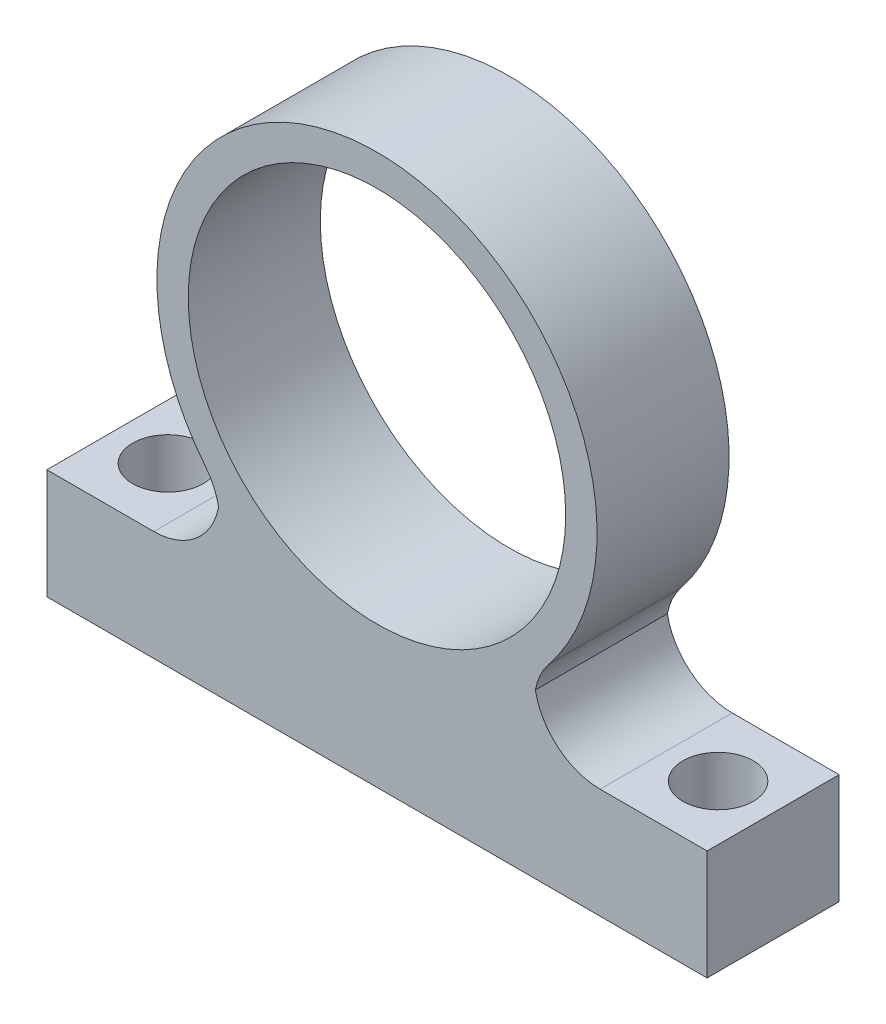
from build123d import *

# Parameters (mm, degrees)
IZIM1_R                     = 10
IZIM1_R_2                   = 8.575
IZIM1_W                     = 30
IZIM1_H                     = 5
Y_KSEKLIK_EKSTR_ZYON1_DEPTH = 6
RADYUS1_R                   = 3
IZIM3_R                     = 1.6
KES_EKSTR_ZYON1_DEPTH       = 6
IZIM2_R                     = 1.6
KES_EKSTR_ZYON2_DEPTH       = 6


with BuildPart() as part:
    # Çizim1 → Yükseklik-Ekstrüzyon1 (new body)
    # profile 1 of 4: a face of its own
    with BuildSketch(Plane.XY):
        with Locations((0, 12.5)):
            Circle(IZIM1_R)
        with Locations((0, 12.5)):
            Circle(IZIM1_R_2, mode=Mode.SUBTRACT)
    # profile 2 of 4: a face of its own
    with BuildSketch(Plane.XY):
        with BuildLine():
            ThreePointArc((7.141428429, 5.5), (3.872983346, 3.280455543), (0, 2.5))
            Line((0, 2.5), (7.141428429, 2.5))
            Line((7.141428429, 2.5), (7.141428429, 5.5))
        make_face()
    # profile 3 of 4: a face of its own
    with BuildSketch(Plane.XY):
        with BuildLine():
            Line((-7.141428429, 5.5), (-7.141428429, 2.5))
            Line((-7.141428429, 2.5), (0, 2.5))
            ThreePointArc((0, 2.5), (-3.872983346, 3.280455543), (-7.141428429, 5.5))
        make_face()
    # profile 4 of 4: a face of its own
    with BuildSketch(Plane.XY):
        Rectangle(IZIM1_W, IZIM1_H)
    extrude(amount=Y_KSEKLIK_EKSTR_ZYON1_DEPTH)

    # Radyus1
    # the kernel refuses this fillet: 3 mm, written as the material it adds along each edge
    with BuildSketch(Plane(origin=(-7.141428429, 2.5, 0), x_dir=(-1, 0, 0), z_dir=(0, 0, 1))) as radyus1_piece_1:
        with BuildLine():
            CenterArc((RADYUS1_R, -RADYUS1_R), RADYUS1_R, 90, 90)
            Line((0, -RADYUS1_R), (0, 0))
            Line((0, 0), (RADYUS1_R, 0))
        make_face()
    extrude(amount=6)
    with BuildSketch(Plane(origin=(-7.141428429, 5.5, 0), x_dir=(0, -1, 0), z_dir=(0, 0, 1))) as radyus1_piece_2:
        with BuildLine():
            CenterArc((1.133352902, -3), RADYUS1_R, 90, 38.729363069)
            ThreePointArc((-0.743574691, -0.659670363), (-0.363585739, -0.33907996), (0, 0))
            Line((0, 0), (1.133352902, 0))
        make_face()
    extrude(amount=6)
    with BuildSketch(Plane(origin=(7.141428429, 5.5, 0), x_dir=(0, -1, 0), z_dir=(0, 0, 1))) as radyus1_piece_3:
        with BuildLine():
            CenterArc((1.133352902, 3), RADYUS1_R, 231.270636931, 38.729363069)
            ThreePointArc((-0.743574691, 0.659670363), (-0.363585739, 0.33907996), (0, 0))
            Line((0, 0), (1.133352902, 0))
        make_face()
    extrude(amount=6)
    with BuildSketch(Plane(origin=(7.141428429, 2.5, 0), x_dir=(1, 0, 0), z_dir=(0, 0, 1))) as radyus1_piece_4:
        with BuildLine():
            CenterArc((RADYUS1_R, RADYUS1_R), RADYUS1_R, 180, 90)
            Line((0, RADYUS1_R), (0, 0))
            Line((0, 0), (RADYUS1_R, 0))
        make_face()
    extrude(amount=6)

    # Çizim3 → Kes-Ekstrüzyon1 (cut)
    with BuildSketch(Plane(origin=(0, 2.5, 0), x_dir=(1, 0, 0), z_dir=(0, 1, 0))):
        with Locations(Location((12.5, -3, 0), (0, 0, 270))):
            Circle(IZIM3_R)
    extrude(amount=-KES_EKSTR_ZYON1_DEPTH, mode=Mode.SUBTRACT)

    # Çizim2 → Kes-Ekstrüzyon2 (cut)
    with BuildSketch(Plane(origin=(0, 2.5, 0), x_dir=(1, 0, 0), z_dir=(0, 1, 0))):
        with Locations(Location((-12.5, -3, 0), (0, 0, 270))):
            Circle(IZIM2_R)
    extrude(amount=-KES_EKSTR_ZYON2_DEPTH, mode=Mode.SUBTRACT)


solid = part.part
